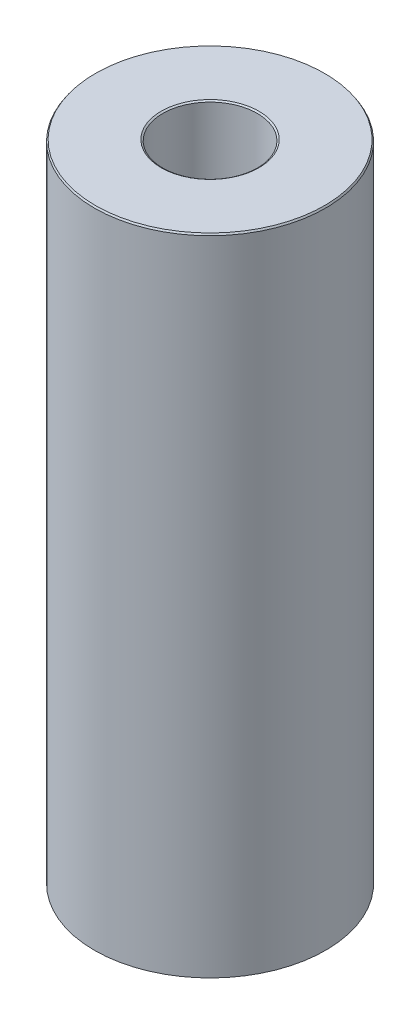
from build123d import *
from OCP.BRepFilletAPI import BRepFilletAPI_MakeChamfer

# Parameters (mm, degrees)
SKETCH1_R           = 17.5
BOSS_EXTRUDE1_DEPTH = 97.689287559
SKETCH2_R           = 7.161975255
CUT_EXTRUDE1_DEPTH  = 101.775477691
CHAMFER1_SIZE       = 0.244702589
CHAMFER1_SIZE2      = 0.163870976


with BuildPart() as part:
    # Sketch1 → Boss-Extrude1 (new body)
    with BuildSketch(Plane(origin=(0, 0, 0), x_dir=(1, 0, 0), z_dir=(0, 1, 0))):
        Circle(SKETCH1_R)
    extrude(amount=BOSS_EXTRUDE1_DEPTH)

    # Sketch2 → Cut-Extrude1 (cut, through all)
    with BuildSketch(Plane(origin=(0, 0, 0), x_dir=(1, 0, 0), z_dir=(0, 1, 0))):
        Circle(SKETCH2_R)
    extrude(amount=CUT_EXTRUDE1_DEPTH, mode=Mode.SUBTRACT)

    # Chamfer1: one chamfer whose edges measure the first distance from different faces: ONE call of the kernel's chamfer builder (chamfer() names one face for all edges)
    chamfer1_edges_1 = [part.edges().sort_by_distance(p)[0] for p in [
        (-7.161975255, 97.689287559, 0),
    ]]
    chamfer1_side_1 = [part.faces().sort_by_distance(p)[0] for p in [
        (-17.005025253, 97.689287559, 0),
    ]]
    chamfer1_edges_2 = [part.edges().sort_by_distance(p)[0] for p in [
        (-7.161975255, 0, 0),
    ]]
    chamfer1_side_2 = [part.faces().sort_by_distance(p)[0] for p in [
        (-7.161975255, 48.84464378, 0),
    ]]
    chamfer1_edges_3 = [part.edges().sort_by_distance(p)[0] for p in [
        (-17.5, 0, 0),
    ]]
    chamfer1_side_3 = [part.faces().sort_by_distance(p)[0] for p in [
        (-17.005025253, 0, 0),
    ]]
    chamfer1_edges_4 = [part.edges().sort_by_distance(p)[0] for p in [
        (-17.5, 97.689287559, 0),
    ]]
    chamfer1_side_4 = [part.faces().sort_by_distance(p)[0] for p in [
        (-17.5, 48.84464378, 0),
    ]]
    chamfer1 = BRepFilletAPI_MakeChamfer(part.part.solid().wrapped)
    for e in chamfer1_edges_1:
        chamfer1.Add(CHAMFER1_SIZE, CHAMFER1_SIZE2, e.wrapped, chamfer1_side_1[0].wrapped)  # the first distance lies on this face
    for e in chamfer1_edges_2:
        chamfer1.Add(CHAMFER1_SIZE, CHAMFER1_SIZE2, e.wrapped, chamfer1_side_2[0].wrapped)  # the first distance lies on this face
    for e in chamfer1_edges_3:
        chamfer1.Add(CHAMFER1_SIZE, CHAMFER1_SIZE2, e.wrapped, chamfer1_side_3[0].wrapped)  # the first distance lies on this face
    for e in chamfer1_edges_4:
        chamfer1.Add(CHAMFER1_SIZE, CHAMFER1_SIZE2, e.wrapped, chamfer1_side_4[0].wrapped)  # the first distance lies on this face
    add(Compound.cast(chamfer1.Shape()), mode=Mode.REPLACE)


solid = part.part
